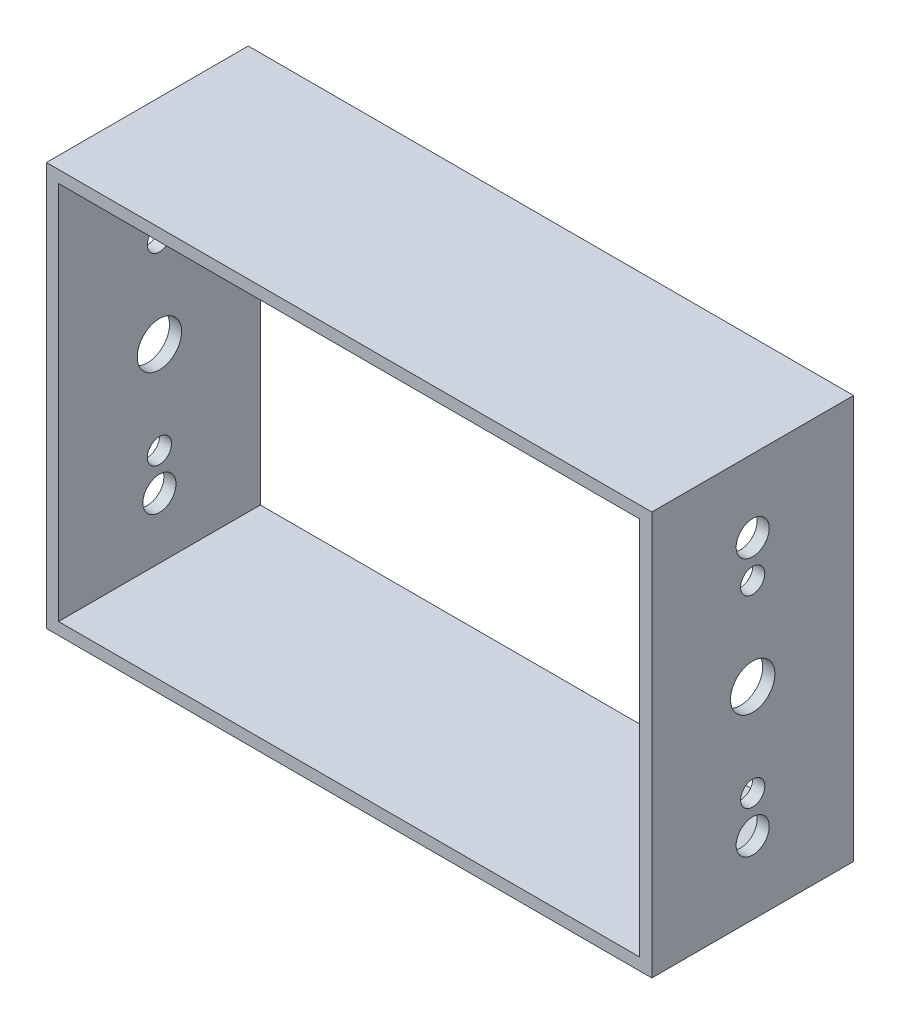
from build123d import *

# Parameters (mm, degrees)
SKETCH1_W           = 150
SKETCH1_H           = 100
SKETCH1_W_2         = 144
SKETCH1_H_2         = 94
BOSS_EXTRUDE1_DEPTH = 50
SKETCH3_R           = 5.5
CUT_EXTRUDE1_DEPTH  = 10
SKETCH4_R           = 4.1
SKETCH4_R_2         = 3
CUT_EXTRUDE2_DEPTH  = 166.831239518


with BuildPart() as part:
    # Sketch1 → Boss-Extrude1 (new body)
    with BuildSketch(Plane.XY):
        Rectangle(SKETCH1_W, SKETCH1_H)
        Rectangle(SKETCH1_W_2, SKETCH1_H_2, mode=Mode.SUBTRACT)
    extrude(amount=BOSS_EXTRUDE1_DEPTH)

    # Sketch3 → Cut-Extrude1 (cut)
    with BuildSketch(Plane(origin=(75, 0, 0), x_dir=(0, 0, -1), z_dir=(1, 0, 0))):
        with Locations((-25, 0)):
            Circle(SKETCH3_R)
    cut_extrude1 = extrude(amount=-CUT_EXTRUDE1_DEPTH, mode=Mode.SUBTRACT)

    # Mirror3: Cut-Extrude1 across plane
    add(cut_extrude1.mirror(Plane(origin=(0, 0, 0), x_dir=(0, 0, 1), z_dir=(1, 0, 0))), mode=Mode.SUBTRACT)

    # Sketch4 → Cut-Extrude2 (cut, through all)
    with BuildSketch(Plane(origin=(75, 0, 0), x_dir=(0, 0, -1), z_dir=(1, 0, 0))):
        with Locations((-25, 32)):
            Circle(SKETCH4_R)
        with Locations((-25, -32)):
            Circle(SKETCH4_R)
        with Locations((-25, 22.81)):
            Circle(SKETCH4_R_2)
        with Locations((-25, -22.81)):
            Circle(SKETCH4_R_2)
    extrude(amount=-CUT_EXTRUDE2_DEPTH, mode=Mode.SUBTRACT)


solid = part.part
